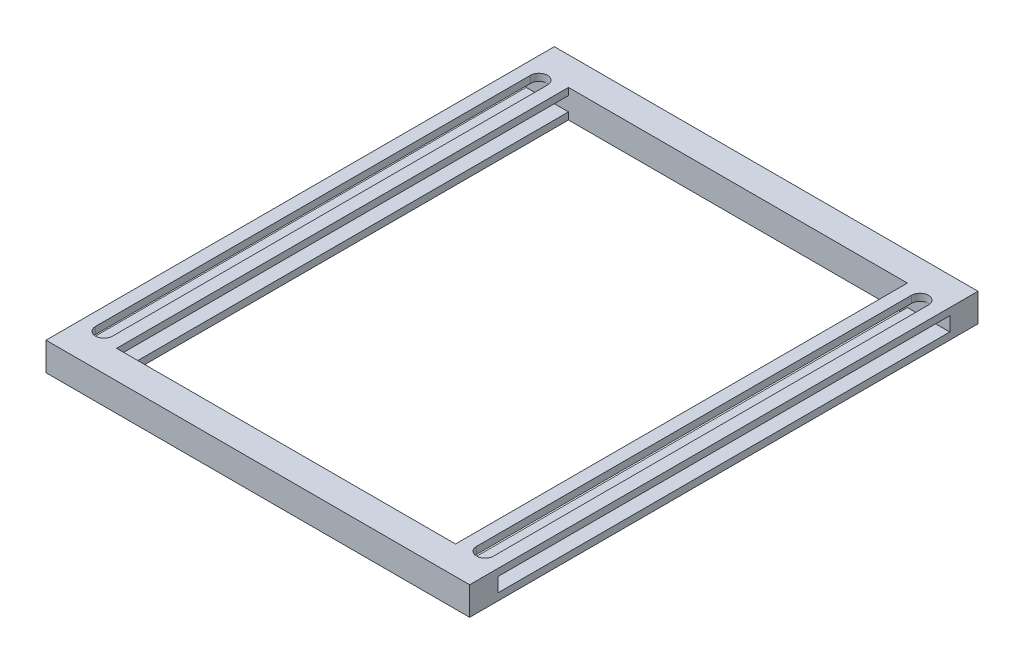
from build123d import *

# Parameters (mm, degrees)
SKETCH1_W           = 150
SKETCH1_H           = 180
SKETCH1_W_2         = 120
SKETCH1_H_2         = 160
BOSS_EXTRUDE1_DEPTH = 10
CUT_EXTRUDE1_DEPTH  = 7
SKETCH3_W           = 160
SKETCH3_H           = 5
CUT_EXTRUDE2_DEPTH  = 200


with BuildPart() as part:
    # Sketch1 → Boss-Extrude1 (new body)
    with BuildSketch(Plane(origin=(0, 0, 0), x_dir=(1, 0, 0), z_dir=(0, 1, 0))):
        with Locations((88.583062215, 79.394161692)):
            Rectangle(SKETCH1_W, SKETCH1_H)
        with Locations((88.583062215, 79.394161692)):
            Rectangle(SKETCH1_W_2, SKETCH1_H_2, mode=Mode.SUBTRACT)
    extrude(amount=BOSS_EXTRUDE1_DEPTH)

    # Sketch2 → Cut-Extrude1 (cut)
    with BuildSketch(Plane(origin=(0, 10, 0), x_dir=(1, 0, 0), z_dir=(0, 1, 0))):
        with BuildLine():
            Line((24.130569034, 156.394161692), (24.130569034, 2.394161692))
            ThreePointArc((24.130569034, 2.394161692), (21.130569034, -0.605838308), (18.130569034, 2.394161692))
            Line((18.130569034, 2.394161692), (18.130569034, 156.394161692))
            ThreePointArc((18.130569034, 156.394161692), (21.130569034, 159.394161692), (24.130569034, 156.394161692))
        make_face()
        with BuildLine():
            Line((153.035555396, 156.394161692), (153.035555396, 2.394161692))
            ThreePointArc((153.035555396, 2.394161692), (156.035555396, -0.605838308), (159.035555396, 2.394161692))
            Line((159.035555396, 2.394161692), (159.035555396, 156.394161692))
            ThreePointArc((159.035555396, 156.394161692), (156.035555396, 159.394161692), (153.035555396, 156.394161692))
        make_face()
    extrude(amount=-CUT_EXTRUDE1_DEPTH, mode=Mode.SUBTRACT)

    # Sketch3 → Cut-Extrude2 (cut)
    with BuildSketch(Plane.ZY.offset(-13.583062215)):
        with Locations((-79.394161692, 5)):
            Rectangle(SKETCH3_W, SKETCH3_H)
    extrude(amount=-CUT_EXTRUDE2_DEPTH, mode=Mode.SUBTRACT)


solid = part.part
